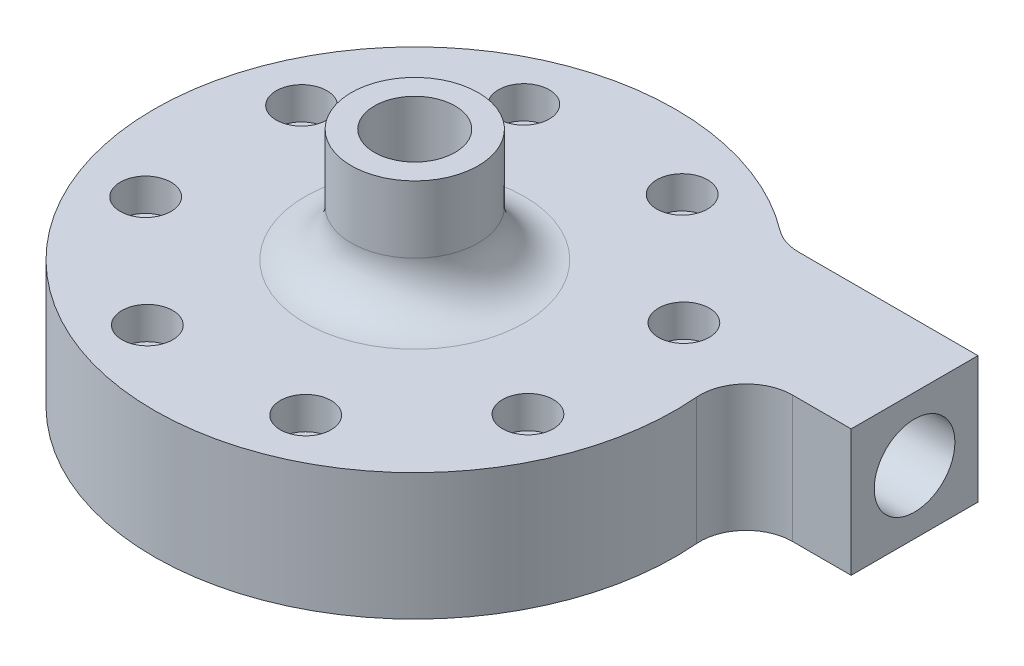
from build123d import *

# Parameters (mm, degrees)
MAIN_BODY_DEPTH           = 27.4625
SKETCH5_R                 = 2.9765625
BOLT_CLEARANCES_DEPTH     = 101.858615827
SKETCH6_R                 = 5.5
BOLT_HEAD_CLEARANCE_DEPTH = 7


with BuildPart() as part:
    # Sketch1 → main body (new body)
    with BuildSketch(Plane(origin=(0, 0, 0), x_dir=(1, 0, 0), z_dir=(0, 1, 0))):
        with BuildLine():
            Line((78.940920787, 29.260248187), (78.940920787, 42.991498187))
            Line((78.940920787, 42.991498187), (40.093685537, 42.991498187))
            ThreePointArc((40.093685537, 42.991498187), (36.91142401, 43.511349898), (34.060023304, 45.016855871))
            ThreePointArc((34.060023304, 45.016855871), (-49.452917381, -27.221525719), (56.254255078, 4.696944284))
            ThreePointArc((56.254255078, 4.696944284), (58.860213164, 12.299502635), (66.219579273, 15.528998187))
            Line((66.219579273, 15.528998187), (78.940920787, 15.528998187))
            Line((78.940920787, 15.528998187), (78.940920787, 29.260248187))
        make_face()
    extrude(amount=MAIN_BODY_DEPTH)

    # Sketch2 → main chamber (revolve, cut)
    with BuildSketch(Plane.XY):
        Polygon((0, 27.4625), (5.4102, 27.4625), (5.4102, 27.775890067), (30.626685, 16.01725), (30.626685, 0), (0, 0), align=None)
    revolve(axis=Axis((0, 0, 0), (0, 1, 0)), mode=Mode.SUBTRACT)

    # Sketch4 → inlet (revolve)
    with BuildSketch(Plane.XY):
        with BuildLine():
            Line((5.4102, 27.4625), (5.4102, 36.947490648))
            Line((5.4102, 36.947490648), (8.73125, 36.947490648))
            Line((8.73125, 36.947490648), (8.73125, 51.947490648))
            Line((8.73125, 51.947490648), (13.73125, 51.947490648))
            Line((13.73125, 51.947490648), (13.73125, 37.4625))
            ThreePointArc((13.73125, 37.4625), (16.660182188, 30.391432188), (23.73125, 27.4625))
            Line((23.73125, 27.4625), (5.4102, 27.4625))
        make_face()
    revolve(axis=Axis((0, 0, 0), (0, 1, 0)))

    # Sketch3 → expansion cone and outlet (revolve, cut)
    with BuildSketch(Plane(origin=(0, 13.73125, 0), x_dir=(1, 0, 0), z_dir=(0, 1, 0))):
        Polygon((2.669291479, 30.510141217), (60.940920787, 35.608248187), (60.940920787, 37.991498187), (78.940920787, 37.991498187), (78.940920787, 29.260248187), (60.940920787, 29.260248187), (2.559940008, 29.260248187), align=None)
    revolve(axis=Axis((60.940920787, 13.73125, -29.260248187), (-1, 0, 0)), mode=Mode.SUBTRACT)

    # Sketch5 → bolt clearances (cut, through all)
    with BuildSketch(Plane(origin=(0, 27.4625, 0), x_dir=(1, 0, 0), z_dir=(0, 1, 0))):
        with Locations((40.934758669, 17.324780886)):
            Circle(SKETCH5_R)
        with Locations((41.195715488, -16.694775394)):
            Circle(SKETCH5_R)
        with Locations((17.324780886, -40.934758669)):
            Circle(SKETCH5_R)
        with Locations((-16.694775394, -41.195715488)):
            Circle(SKETCH5_R)
        with Locations((-40.934758669, -17.324780886)):
            Circle(SKETCH5_R)
        with Locations((-41.195715488, 16.694775394)):
            Circle(SKETCH5_R)
        with Locations((-17.324780886, 40.934758669)):
            Circle(SKETCH5_R)
        with Locations((16.694775394, 41.195715488)):
            Circle(SKETCH5_R)
    extrude(amount=-BOLT_CLEARANCES_DEPTH, mode=Mode.SUBTRACT)

    # Sketch6 → bolt head clearance (cut)
    with BuildSketch(Plane(origin=(0, 27.4625, 0), x_dir=(1, 0, 0), z_dir=(0, 1, 0))):
        with Locations((40.934758669, 17.324780886)):
            Circle(SKETCH6_R)
        with Locations((41.195715488, -16.694775394)):
            Circle(SKETCH6_R)
        with Locations((17.324780886, -40.934758669)):
            Circle(SKETCH6_R)
        with Locations((-16.694775394, -41.195715488)):
            Circle(SKETCH6_R)
        with Locations((-40.934758669, -17.324780886)):
            Circle(SKETCH6_R)
        with Locations((-41.195715488, 16.694775394)):
            Circle(SKETCH6_R)
        with Locations((-17.324780886, 40.934758669)):
            Circle(SKETCH6_R)
        with Locations((16.694775394, 41.195715488)):
            Circle(SKETCH6_R)
    extrude(amount=-BOLT_HEAD_CLEARANCE_DEPTH, mode=Mode.SUBTRACT)


solid = part.part
